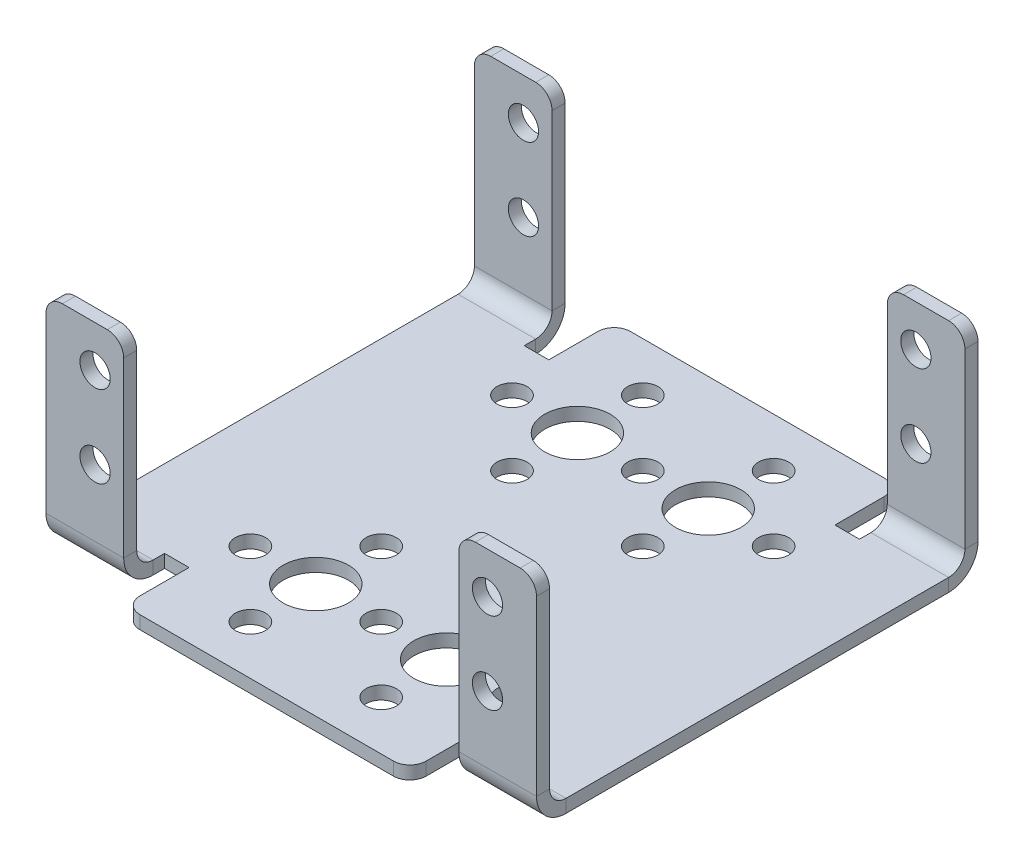
from build123d import *

# Parameters (mm, degrees)
BASE_FLANGE1_DEPTH             = 1.6
EDGE_FLANGE1_STRIP_W           = 10.4
EDGE_FLANGE1_STRIP_H           = 1.6
EDGE_FLANGE1_STRIP_CUT_DEPTH   = 9.5
EDGE_FLANGE1_STRIP_2_W         = 10.4
EDGE_FLANGE1_STRIP_2_H         = 1.6
EDGE_FLANGE1_STRIP_CUT_2_DEPTH = 9.5
EDGE_FLANGE1_DEPTH             = 9.5
EDGE_FLANGE1_BEND_DEPTH        = 9.5
CUT_EXTRUDE1_REACH             = 51.346
SKETCH15_R                     = 1.85
SKETCH15_R_2                   = 4
CUT_EXTRUDE2_REACH             = 50.448
SKETCH16_R                     = 1.85
FILLET1_R                      = 2


# Sheet-metal steps are written as plain solids
with BuildPart() as part:
    # Sketch1 → Base-Flange1 (new body)
    with BuildSketch(Plane(origin=(0, 0, 0), x_dir=(1, 0, 0), z_dir=(0, 1, 0))):
        Polygon((-30, 0), (30, 0), (30, -27), (20.5, -27), (20.5, -22), (17.5, -22), (17.5, -30), (-17.5, -30), (-17.5, -22), (-20.5, -22), (-20.5, -27), (-30, -27), align=None)
    extrude(amount=BASE_FLANGE1_DEPTH)

    # Edge-Flange1 strip (across the edge) → Edge-Flange1 strip cut (cut)
    with BuildSketch(Plane(origin=(20.5, 1.6, 27), x_dir=(0, 0, -1), z_dir=(1, 0, 0))):
        with Locations((-1.6, -0.8)):
            Rectangle(EDGE_FLANGE1_STRIP_W, EDGE_FLANGE1_STRIP_H)
    extrude(amount=EDGE_FLANGE1_STRIP_CUT_DEPTH, mode=Mode.SUBTRACT)

    # Edge-Flange1 strip 2 (across the edge) → Edge-Flange1 strip cut 2 (cut)
    with BuildSketch(Plane(origin=(-30, 1.6, 27), x_dir=(0, 0, -1), z_dir=(1, 0, 0))):
        with Locations((-1.6, -0.8)):
            Rectangle(EDGE_FLANGE1_STRIP_2_W, EDGE_FLANGE1_STRIP_2_H)
    extrude(amount=EDGE_FLANGE1_STRIP_CUT_2_DEPTH, mode=Mode.SUBTRACT)

    # Edge-Flange1 section (across the edge) → Edge-Flange1 (add)
    with BuildSketch(Plane(origin=(20.5, 1.6, 27), x_dir=(0, 0, -1), z_dir=(1, 0, 0))):
        with BuildLine():
            Line((0, 2), (0, 25.2))
            Line((0, 25.2), (1.6, 25.2))
            Line((1.6, 25.2), (1.6, 2))
            ThreePointArc((1.6, 2), (2.185786438, 0.585786438), (3.6, 0))
            Line((3.6, 0), (3.6, -1.6))
            ThreePointArc((3.6, -1.6), (1.054415588, -0.545584412), (0, 2))
        make_face()
    extrude(amount=EDGE_FLANGE1_DEPTH)

    # Edge-Flange1 section 2 (across the edge) → Edge-Flange1 bend (add)
    with BuildSketch(Plane(origin=(-30, 1.6, 27), x_dir=(0, 0, -1), z_dir=(1, 0, 0))):
        with BuildLine():
            Line((0, 2), (0, 25.2))
            Line((0, 25.2), (1.6, 25.2))
            Line((1.6, 25.2), (1.6, 2))
            ThreePointArc((1.6, 2), (2.185786438, 0.585786438), (3.6, 0))
            Line((3.6, 0), (3.6, -1.6))
            ThreePointArc((3.6, -1.6), (1.054415588, -0.545584412), (0, 2))
        make_face()
    extrude(amount=EDGE_FLANGE1_BEND_DEPTH)

    # Sketch15 → Cut-Extrude1 (cut, up to next)
    with BuildSketch(Plane(origin=(0, 1.6, 0), x_dir=(1, 0, 0), z_dir=(0, 1, 0)), mode=Mode.PRIVATE) as cut_extrude1_sk1:
        with Locations(Location((0, -16, 0), (0, 0, 270))):
            Circle(SKETCH15_R)
    cut_extrude1_tool1 = extrude(cut_extrude1_sk1.sketch, amount=-CUT_EXTRUDE1_REACH, mode=Mode.PRIVATE) & part.part
    # Sketch15 → Cut-Extrude1 (cut, up to next)
    with BuildSketch(Plane(origin=(0, 1.6, 0), x_dir=(1, 0, 0), z_dir=(0, 1, 0)), mode=Mode.PRIVATE) as cut_extrude1_sk2:
        with Locations(Location((8, -16, 0), (0, 0, 270))):
            Circle(SKETCH15_R_2)
    cut_extrude1_tool2 = extrude(cut_extrude1_sk2.sketch, amount=-CUT_EXTRUDE1_REACH, mode=Mode.PRIVATE) & part.part
    # Sketch15 → Cut-Extrude1 (cut, up to next)
    with BuildSketch(Plane(origin=(0, 1.6, 0), x_dir=(1, 0, 0), z_dir=(0, 1, 0)), mode=Mode.PRIVATE) as cut_extrude1_sk3:
        with Locations(Location((-8, -16, 0), (0, 0, 270))):
            Circle(SKETCH15_R_2)
    cut_extrude1_tool3 = extrude(cut_extrude1_sk3.sketch, amount=-CUT_EXTRUDE1_REACH, mode=Mode.PRIVATE) & part.part
    # Sketch15 → Cut-Extrude1 (cut, up to next)
    with BuildSketch(Plane(origin=(0, 1.6, 0), x_dir=(1, 0, 0), z_dir=(0, 1, 0)), mode=Mode.PRIVATE) as cut_extrude1_sk4:
        with Locations(Location((16, -16, 0), (0, 0, 270))):
            Circle(SKETCH15_R)
    cut_extrude1_tool4 = extrude(cut_extrude1_sk4.sketch, amount=-CUT_EXTRUDE1_REACH, mode=Mode.PRIVATE) & part.part
    # Sketch15 → Cut-Extrude1 (cut, up to next)
    with BuildSketch(Plane(origin=(0, 1.6, 0), x_dir=(1, 0, 0), z_dir=(0, 1, 0)), mode=Mode.PRIVATE) as cut_extrude1_sk5:
        with Locations(Location((-16, -16, 0), (0, 0, 270))):
            Circle(SKETCH15_R)
    cut_extrude1_tool5 = extrude(cut_extrude1_sk5.sketch, amount=-CUT_EXTRUDE1_REACH, mode=Mode.PRIVATE) & part.part
    # Sketch15 → Cut-Extrude1 (cut, up to next)
    with BuildSketch(Plane(origin=(0, 1.6, 0), x_dir=(1, 0, 0), z_dir=(0, 1, 0)), mode=Mode.PRIVATE) as cut_extrude1_sk6:
        with Locations(Location((-8, -8, 0), (0, 0, 270))):
            Circle(SKETCH15_R)
    cut_extrude1_tool6 = extrude(cut_extrude1_sk6.sketch, amount=-CUT_EXTRUDE1_REACH, mode=Mode.PRIVATE) & part.part
    # Sketch15 → Cut-Extrude1 (cut, up to next)
    with BuildSketch(Plane(origin=(0, 1.6, 0), x_dir=(1, 0, 0), z_dir=(0, 1, 0)), mode=Mode.PRIVATE) as cut_extrude1_sk7:
        with Locations(Location((-8, -24, 0), (0, 0, 270))):
            Circle(SKETCH15_R)
    cut_extrude1_tool7 = extrude(cut_extrude1_sk7.sketch, amount=-CUT_EXTRUDE1_REACH, mode=Mode.PRIVATE) & part.part
    # Sketch15 → Cut-Extrude1 (cut, up to next)
    with BuildSketch(Plane(origin=(0, 1.6, 0), x_dir=(1, 0, 0), z_dir=(0, 1, 0)), mode=Mode.PRIVATE) as cut_extrude1_sk8:
        with Locations(Location((8, -24, 0), (0, 0, 270))):
            Circle(SKETCH15_R)
    cut_extrude1_tool8 = extrude(cut_extrude1_sk8.sketch, amount=-CUT_EXTRUDE1_REACH, mode=Mode.PRIVATE) & part.part
    # Sketch15 → Cut-Extrude1 (cut, up to next)
    with BuildSketch(Plane(origin=(0, 1.6, 0), x_dir=(1, 0, 0), z_dir=(0, 1, 0)), mode=Mode.PRIVATE) as cut_extrude1_sk9:
        with Locations(Location((8, -8, 0), (0, 0, 270))):
            Circle(SKETCH15_R)
    cut_extrude1_tool9 = extrude(cut_extrude1_sk9.sketch, amount=-CUT_EXTRUDE1_REACH, mode=Mode.PRIVATE) & part.part
    add(cut_extrude1_tool1.solids().sort_by_distance((0, 1.6, 16))[0], mode=Mode.SUBTRACT)
    add(cut_extrude1_tool2.solids().sort_by_distance((8, 1.6, 16))[0], mode=Mode.SUBTRACT)
    add(cut_extrude1_tool3.solids().sort_by_distance((-8, 1.6, 16))[0], mode=Mode.SUBTRACT)
    add(cut_extrude1_tool4.solids().sort_by_distance((16, 1.6, 16))[0], mode=Mode.SUBTRACT)
    add(cut_extrude1_tool5.solids().sort_by_distance((-16, 1.6, 16))[0], mode=Mode.SUBTRACT)
    add(cut_extrude1_tool6.solids().sort_by_distance((-8, 1.6, 8))[0], mode=Mode.SUBTRACT)
    add(cut_extrude1_tool7.solids().sort_by_distance((-8, 1.6, 24))[0], mode=Mode.SUBTRACT)
    add(cut_extrude1_tool8.solids().sort_by_distance((8, 1.6, 24))[0], mode=Mode.SUBTRACT)
    add(cut_extrude1_tool9.solids().sort_by_distance((8, 1.6, 8))[0], mode=Mode.SUBTRACT)

    # Sketch16 → Cut-Extrude2 (cut, up to next)
    with BuildSketch(Plane.XY.offset(27), mode=Mode.PRIVATE) as cut_extrude2_sk1:
        with Locations((-24, 21.75)):
            Circle(SKETCH16_R)
    cut_extrude2_tool1 = extrude(cut_extrude2_sk1.sketch, amount=-CUT_EXTRUDE2_REACH, mode=Mode.PRIVATE) & part.part
    # Sketch16 → Cut-Extrude2 (cut, up to next)
    with BuildSketch(Plane.XY.offset(27), mode=Mode.PRIVATE) as cut_extrude2_sk2:
        with Locations((-24, 11.75)):
            Circle(SKETCH16_R)
    cut_extrude2_tool2 = extrude(cut_extrude2_sk2.sketch, amount=-CUT_EXTRUDE2_REACH, mode=Mode.PRIVATE) & part.part
    # Sketch16 → Cut-Extrude2 (cut, up to next)
    with BuildSketch(Plane.XY.offset(27), mode=Mode.PRIVATE) as cut_extrude2_sk3:
        with Locations((24, 21.75)):
            Circle(SKETCH16_R)
    cut_extrude2_tool3 = extrude(cut_extrude2_sk3.sketch, amount=-CUT_EXTRUDE2_REACH, mode=Mode.PRIVATE) & part.part
    # Sketch16 → Cut-Extrude2 (cut, up to next)
    with BuildSketch(Plane.XY.offset(27), mode=Mode.PRIVATE) as cut_extrude2_sk4:
        with Locations((24, 11.75)):
            Circle(SKETCH16_R)
    cut_extrude2_tool4 = extrude(cut_extrude2_sk4.sketch, amount=-CUT_EXTRUDE2_REACH, mode=Mode.PRIVATE) & part.part
    add(cut_extrude2_tool1.solids().sort_by_distance((-24, 21.75, 27))[0], mode=Mode.SUBTRACT)
    add(cut_extrude2_tool2.solids().sort_by_distance((-24, 11.75, 27))[0], mode=Mode.SUBTRACT)
    add(cut_extrude2_tool3.solids().sort_by_distance((24, 21.75, 27))[0], mode=Mode.SUBTRACT)
    add(cut_extrude2_tool4.solids().sort_by_distance((24, 11.75, 27))[0], mode=Mode.SUBTRACT)

    # Fillet1
    fillet1_edges = [part.edges().sort_by_distance(p)[0] for p in [
        (17.5, 0.8, 30),
        (-17.5, 0.8, 30),
        (20.5, 26.8, 26.2),
        (30, 26.8, 26.2),
        (-30, 26.8, 26.2),
        (-20.5, 26.8, 26.2),
    ]]
    fillet(fillet1_edges, radius=FILLET1_R)

    # Mirror1: part across plane


with BuildPart() as part_1:
    add(part.part)
    add(part.part.mirror(Plane(origin=(-30, 1.6, 0), x_dir=(1, 0, 0), z_dir=(0, 0, 1))))


solid = part_1.part
